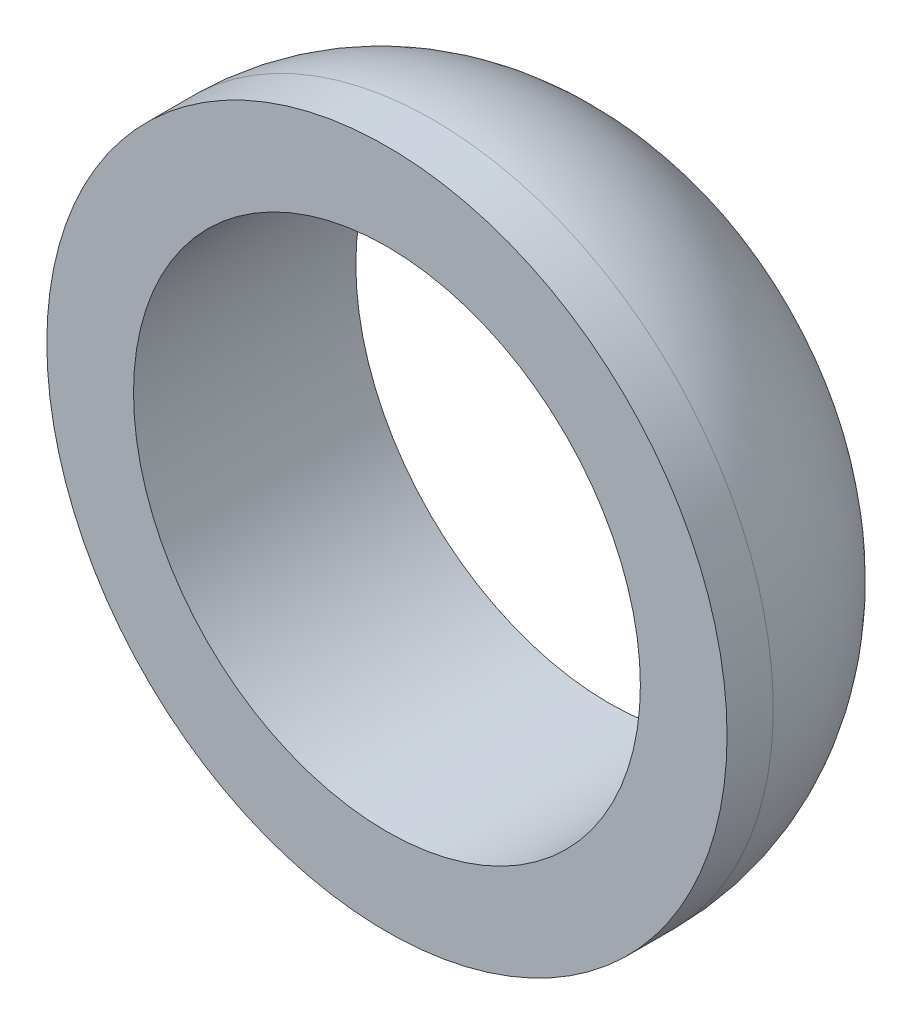
from build123d import *

# Parameters (mm, degrees)
SKETCH2_R           = 19.431
BOSS_EXTRUDE1_DEPTH = 12.7
SKETCH4_R           = 14.478
CUT_EXTRUDE1_DEPTH  = 12.7
FILLET2_R           = 12.7


with BuildPart() as part:
    # Sketch2 → Boss-Extrude1 (new body)
    with BuildSketch(Plane.XY):
        with Locations((-9.841060776, 7.992739717)):
            Circle(SKETCH2_R)
    extrude(amount=BOSS_EXTRUDE1_DEPTH)

    # Sketch4 → Cut-Extrude1 (cut)
    with BuildSketch(Plane(origin=(0, 0, 0), x_dir=(-1, 0, 0), z_dir=(0, 0, -1))):
        with Locations((9.841060776, 7.992739717)):
            Circle(SKETCH4_R)
    extrude(amount=-CUT_EXTRUDE1_DEPTH, mode=Mode.SUBTRACT)

    # Fillet2
    # the kernel refuses this fillet: 12.7 mm, written as the material it takes off along each edge
    with BuildSketch(Plane(origin=(-9.841060776, 7.992739717, 0), x_dir=(1, 0, 0), z_dir=(0, -1, 0))) as fillet2_piece_1:
        with BuildLine():
            CenterArc((6.731, 10.063497951), FILLET2_R, 307.589502965, 52.410497035)
            Line((14.478, 0), (14.63294, -0.201269959))
            ThreePointArc((14.63294, -0.201269959), (16.9545, -0.254), (19.431, -0.254))
            Line((19.431, -0.254), (19.685, 0))
            Line((19.685, 0), (19.685, 10.063497951))
            Line((19.685, 10.063497951), (19.431, 10.063497951))
        make_face()
    revolve(axis=Axis((-9.841060776, 7.992739717, 0), (0, 0, 1)), mode=Mode.SUBTRACT)


solid = part.part
